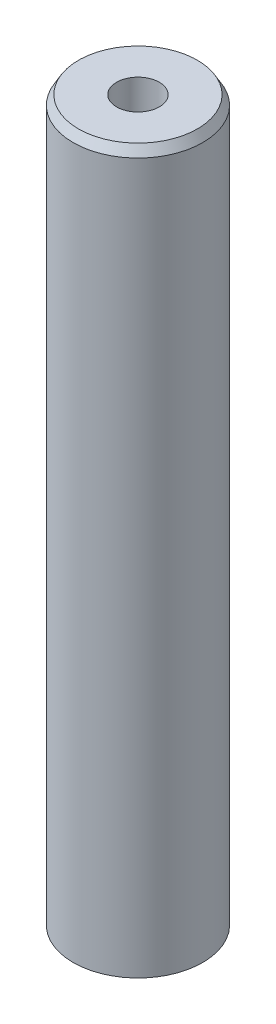
from build123d import *
from OCP.BRepFilletAPI import BRepFilletAPI_MakeChamfer

# Parameters (mm, degrees)
SKETCH1_R           = 10
BOSS_EXTRUDE1_DEPTH = 111.814988323
SKETCH2_R           = 3.299480561
CUT_EXTRUDE1_DEPTH  = 113.705774536
CHAMFER1_SIZE       = 1.420428001
CHAMFER1_SIZE2      = 0.820084489


with BuildPart() as part:
    # Sketch1 → Boss-Extrude1 (new body)
    with BuildSketch(Plane(origin=(0, 0, 0), x_dir=(1, 0, 0), z_dir=(0, 1, 0))):
        Circle(SKETCH1_R)
    extrude(amount=BOSS_EXTRUDE1_DEPTH)

    # Sketch2 → Cut-Extrude1 (cut, through all)
    with BuildSketch(Plane(origin=(0, 0, 0), x_dir=(1, 0, 0), z_dir=(0, 1, 0))):
        Circle(SKETCH2_R)
    extrude(amount=CUT_EXTRUDE1_DEPTH, mode=Mode.SUBTRACT)

    # Chamfer1: one chamfer whose edges measure the first distance from different faces: ONE call of the kernel's chamfer builder (chamfer() names one face for all edges)
    chamfer1_edges_1 = [part.edges().sort_by_distance(p)[0] for p in [
        (-10, 111.814988323, 0),
    ]]
    chamfer1_side_1 = [part.faces().sort_by_distance(p)[0] for p in [
        (-10, 55.907494162, 0),
    ]]
    chamfer1_edges_2 = [part.edges().sort_by_distance(p)[0] for p in [
        (-10, 0, 0),
    ]]
    chamfer1_side_2 = [part.faces().sort_by_distance(p)[0] for p in [
        (-9.717157288, 0, 0),
    ]]
    chamfer1 = BRepFilletAPI_MakeChamfer(part.part.solid().wrapped)
    for e in chamfer1_edges_1:
        chamfer1.Add(CHAMFER1_SIZE, CHAMFER1_SIZE2, e.wrapped, chamfer1_side_1[0].wrapped)  # the first distance lies on this face
    for e in chamfer1_edges_2:
        chamfer1.Add(CHAMFER1_SIZE, CHAMFER1_SIZE2, e.wrapped, chamfer1_side_2[0].wrapped)  # the first distance lies on this face
    add(Compound.cast(chamfer1.Shape()), mode=Mode.REPLACE)


solid = part.part
